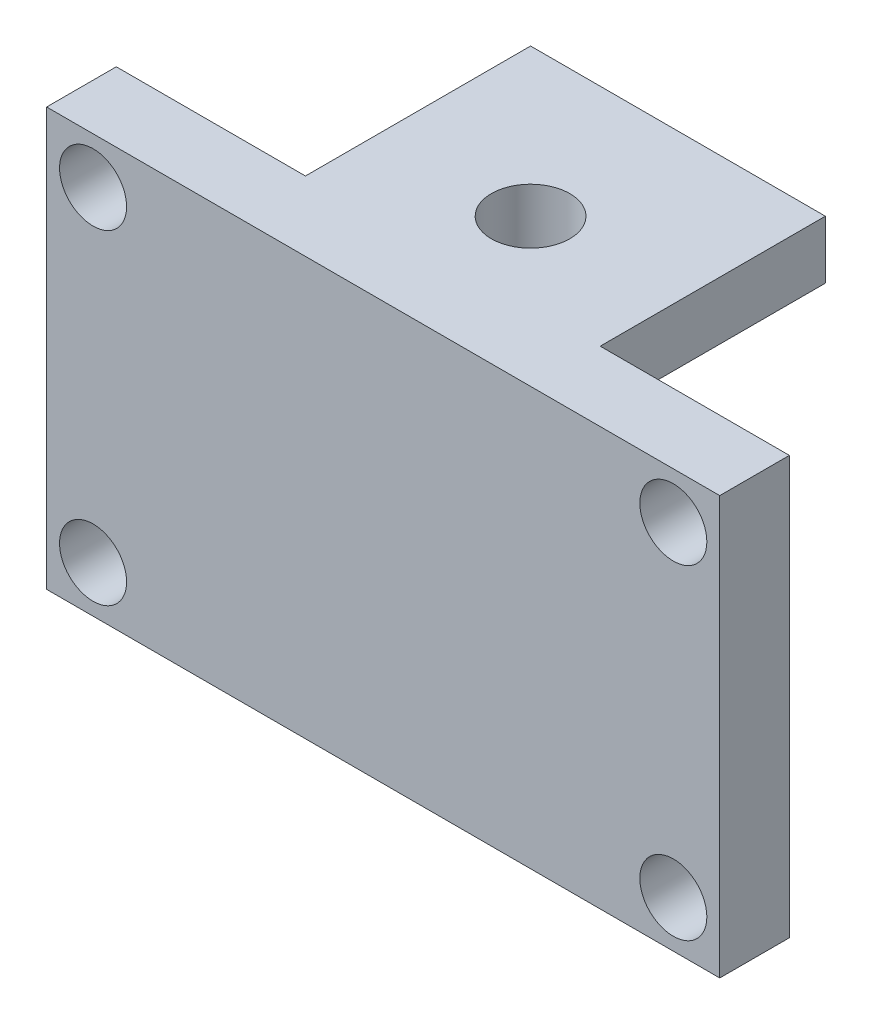
from build123d import *

# Parameters (mm, degrees)
SKETCH1_W               = 25.4
SKETCH1_H               = 25.4
BOSS_EXTRUDE1_DEPTH     = 5
F_1_4_CLEARANCE_HOLE1_D = 6.7564
SKETCH4_R               = 2.887928546
BOSS_EXTRUDE2_DEPTH     = 6


with BuildPart() as part:
    # Sketch1 → Boss-Extrude1 (new body)
    with BuildSketch(Plane(origin=(0, 0, 0), x_dir=(1, 0, 0), z_dir=(0, 1, 0))):
        Rectangle(SKETCH1_W, SKETCH1_H)
    extrude(amount=BOSS_EXTRUDE1_DEPTH)

    # 1/4 Clearance Hole1 (through all)
    with Locations(Plane(origin=(0, 5, 0), x_dir=(1, 0, 0), z_dir=(0, 1, 0))):
        with Locations((0, 0)):
            Hole(F_1_4_CLEARANCE_HOLE1_D / 2)

    # Sketch4 → Boss-Extrude2 (add)
    with BuildSketch(Plane.XY.offset(12.7)):
        Polygon((-29, 5), (-29, -31), (29, -31), (29, 5), (12.7, 5), (12.7, 0), (-12.7, 0), (-12.7, 5), align=None)
        with Locations((-25, -27)):
            Circle(SKETCH4_R, mode=Mode.SUBTRACT)
        with Locations((25, -27)):
            Circle(SKETCH4_R, mode=Mode.SUBTRACT)
        with Locations((-25, 1)):
            Circle(SKETCH4_R, mode=Mode.SUBTRACT)
        with Locations((25, 1)):
            Circle(SKETCH4_R, mode=Mode.SUBTRACT)
    extrude(amount=-BOSS_EXTRUDE2_DEPTH)


solid = part.part
